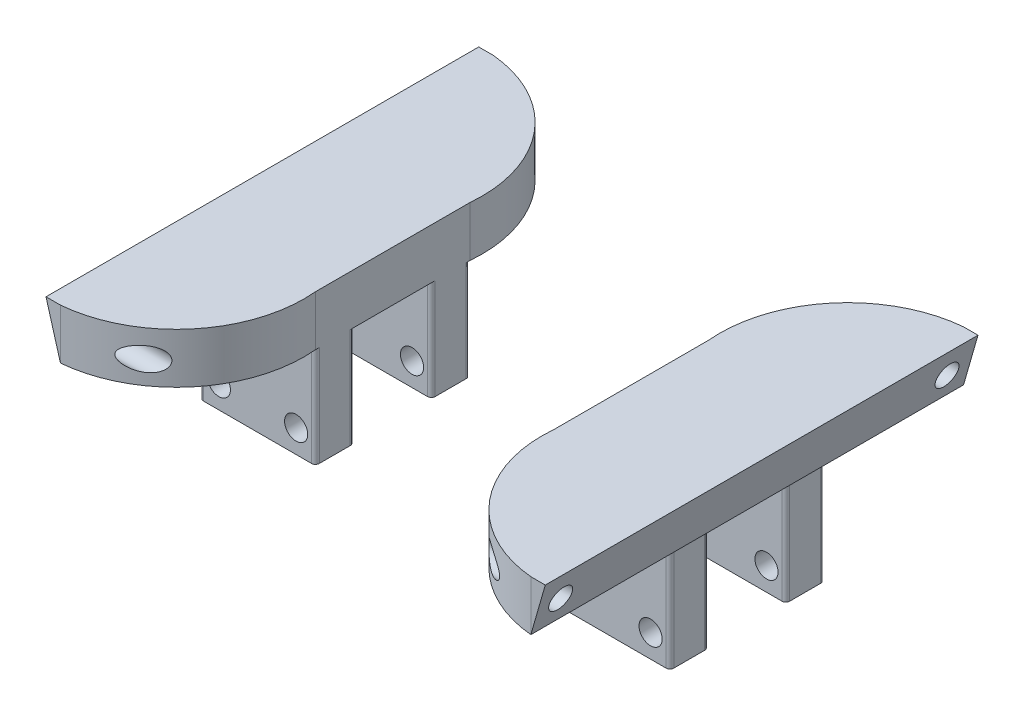
from build123d import *

# Parameters (mm, degrees)
BOSS_EXTRUDE1_DEPTH     = 62
CUT_EXTRUDE1_DEPTH      = 62
CUT_EXTRUDE1_DEPTH_BACK = 62
SKETCH2_R               = 1.5
CUT_EXTRUDE2_DEPTH      = 62
CUT_EXTRUDE2_DEPTH_BACK = 62
SKETCH3_W               = 8.022178305
SKETCH3_H               = 21.045195033
CUT_EXTRUDE3_DEPTH      = 62
CUT_EXTRUDE3_DEPTH_BACK = 62
SKETCH4_W               = 61.260270692
SKETCH4_H               = 6.493024082
SKETCH5_W               = 24.437419654
SKETCH5_H               = 5
BOSS_EXTRUDE2_DEPTH     = 13
SKETCH7_R               = 1.5
SKETCH7_W               = 30.874839308
SKETCH7_H               = 16.235122229
CUT_EXTRUDE4_DEPTH      = 23
CUT_EXTRUDE5_DEPTH      = 20
CUT_EXTRUDE5_DEPTH_BACK = 21
FILLET1_R               = 0.5
FILLET2_R               = 0.5
FILLET3_R               = 0.5
FILLET4_R               = 0.5
FILLET5_R               = 0.5
FILLET6_R               = 0.5
FILLET7_R               = 0.5
FILLET8_R               = 0.5
FILLET9_R               = 0.5
FILLET10_R              = 0.5
FILLET11_R              = 0.5
FILLET12_R              = 0.5
FILLET13_R              = 0.5
FILLET14_R              = 0.5
FILLET15_R              = 0.5
FILLET16_R              = 0.5


with BuildPart() as part:
    # Sketch1 → Boss-Extrude1 (new body)
    with BuildSketch(Plane.XY):
        Polygon((-42.357341369, -80), (17.367493653, -80), (19.811252759, -71.5), (-44.801100475, -71.5), align=None)
    extrude(amount=BOSS_EXTRUDE1_DEPTH)

    # Sketch2 → Cut-Extrude1 (cut, two sides: drawn at the far end of the back side and taken through both)
    with BuildSketch(Plane(origin=(0, 0, 0), x_dir=(0, 0, -1), z_dir=(1, 0, 0)).offset(-CUT_EXTRUDE1_DEPTH_BACK)):
        with Locations(Location((-53, -75, 0), (0, 0, 90))):
            Circle(SKETCH2_R)
        with Locations(Location((-3, -75, 0), (0, 0, 90))):
            Circle(SKETCH2_R)
    extrude(amount=CUT_EXTRUDE1_DEPTH + CUT_EXTRUDE1_DEPTH_BACK, mode=Mode.SUBTRACT)

    # Sketch3 → Cut-Extrude2 (cut, two sides: drawn at the far end of the back side and taken through both)
    with BuildSketch(Plane(origin=(0, 0, 0), x_dir=(0, 0, -1), z_dir=(1, 0, 0)).offset(-CUT_EXTRUDE2_DEPTH_BACK)):
        with Locations((-60.011089152, -76.583473071)):
            Rectangle(SKETCH3_W, SKETCH3_H)
    extrude(amount=CUT_EXTRUDE2_DEPTH + CUT_EXTRUDE2_DEPTH_BACK, mode=Mode.SUBTRACT)

    # Sketch4 → Cut-Extrude3 (cut, two sides: drawn at the far end of the back side and taken through both)
    with BuildSketch(Plane(origin=(0, 0, 0), x_dir=(0, 0, -1), z_dir=(1, 0, 0)).offset(-CUT_EXTRUDE3_DEPTH_BACK)):
        with Locations((-28, -81.246512041)):
            Rectangle(SKETCH4_W, SKETCH4_H)
    extrude(amount=CUT_EXTRUDE3_DEPTH + CUT_EXTRUDE3_DEPTH_BACK, mode=Mode.SUBTRACT)

    # Sketch5 → Boss-Extrude2 (add)
    with BuildSketch(Plane.XZ.offset(78)):
        with Locations((-30.713633685, 35.5)):
            Rectangle(SKETCH5_W, SKETCH5_H)
        with Locations((5.723785969, 35.5)):
            Rectangle(SKETCH5_W, SKETCH5_H)
        with Locations((-30.713633685, 20.5)):
            Rectangle(SKETCH5_W, SKETCH5_H)
        with Locations((5.723785969, 20.5)):
            Rectangle(SKETCH5_W, SKETCH5_H)
    extrude(amount=BOSS_EXTRUDE2_DEPTH)

    # Sketch7 → Cut-Extrude4 (cut)
    with BuildSketch(Plane(origin=(0, 0, 18), x_dir=(-1, 0, 0), z_dir=(0, 0, -1))):
        with Locations((-15.442495796, -88)):
            Circle(SKETCH7_R)
        with Locations((-5.442495796, -88)):
            Circle(SKETCH7_R)
        with Locations((30.432343512, -88)):
            Circle(SKETCH7_R)
        with Locations((40.432343512, -88)):
            Circle(SKETCH7_R)
        with Locations((12.494923858, -86.117561115)):
            Rectangle(SKETCH7_W, SKETCH7_H)
    extrude(amount=-CUT_EXTRUDE4_DEPTH, mode=Mode.SUBTRACT)

    # Sketch8 → Cut-Extrude5 (cut, two sides: drawn at the far end of the back side and taken through both)
    with BuildSketch(Plane.XZ.offset(78).offset(-CUT_EXTRUDE5_DEPTH_BACK)):
        with BuildLine():
            ThreePointArc((-42.932343512, 56), (-31.70442145, 50.106601718), (-27.932343512, 38))
            Line((-27.932343512, 38), (-27.932343512, 33))
            Line((-27.932343512, 33), (-27.932343512, 23))
            Line((-27.932343512, 23), (-27.932343512, 18))
            ThreePointArc((-27.932343512, 18), (-31.70442145, 5.893398282), (-42.932343512, 0))
            Line((-42.932343512, 0), (17.942495796, 0))
            ThreePointArc((17.942495796, 0), (6.714573734, 5.893398282), (2.942495796, 18))
            Line((2.942495796, 18), (2.942495796, 23))
            Line((2.942495796, 23), (2.942495796, 33))
            Line((2.942495796, 33), (2.942495796, 38))
            ThreePointArc((2.942495796, 38), (6.714573734, 50.106601718), (17.942495796, 56))
            Line((17.942495796, 56), (-42.932343512, 56))
        make_face()
    extrude(amount=CUT_EXTRUDE5_DEPTH + CUT_EXTRUDE5_DEPTH_BACK, mode=Mode.SUBTRACT)


with BuildPart() as cut_extrude5_piece_1:
    # of the separate pieces the step leaves, piece 1, a body of its own (cut_extrude5_pieces)
    add(part.part.solids().sort_by_distance((17.942495796, -71.5, 0))[0])

    # Fillet1
    fillet1_edges = [cut_extrude5_piece_1.edges().sort_by_distance(p)[0] for p in [
        (17.942495796, -84.5, 33),
    ]]
    fillet(fillet1_edges, radius=FILLET1_R)

    # Fillet2
    fillet2_edges = [cut_extrude5_piece_1.edges().sort_by_distance(p)[0] for p in [
        (17.942495796, -84.5, 38),
    ]]
    fillet(fillet2_edges, radius=FILLET2_R)

    # Fillet3
    # the kernel refuses this fillet: 0.5 mm, written as the material it takes off along each edge
    with BuildSketch(Plane(origin=(17.942495796, -78, 23), x_dir=(-1, 0, 0), z_dir=(0, -1, 0))) as fillet3_piece_1_section:
        with BuildLine():
            CenterArc((FILLET3_R, FILLET3_R), FILLET3_R, 180, 90)
            Line((0, FILLET3_R), (0, 0))
            Line((0, 0), (FILLET3_R, 0))
        make_face()
    fillet3_piece_1 = extrude(amount=14.25, mode=Mode.PRIVATE)
    fillet3_piece_1 = split(fillet3_piece_1, bisect_by=Plane(origin=(17.826756801, -78.402568918, 22.946763744), z_dir=(-0.9610690305242926, 0.2763083758540381, 0)), keep=Keep.TOP, mode=Mode.PRIVATE)
    add(fillet3_piece_1, mode=Mode.SUBTRACT)
    with BuildSketch(Plane(origin=(17.942495796, -78, 23), x_dir=(-1, 0, 0), z_dir=(0, -1, 0))) as fillet3_piece_2_section:
        with BuildLine():
            CenterArc((FILLET3_R, FILLET3_R), FILLET3_R, 180, 90)
            Line((0, FILLET3_R), (0, 0))
            Line((0, 0), (FILLET3_R, 0))
        make_face()
    fillet3_piece_2 = extrude(amount=14.25, mode=Mode.PRIVATE)
    fillet3_piece_2 = split(fillet3_piece_2, bisect_by=Plane(origin=(15.990895382, -84.788150058, 22.885092436), z_dir=(0.9610690305242926, -0.2763083758540381, 0)), keep=Keep.TOP, mode=Mode.PRIVATE)
    add(fillet3_piece_2, mode=Mode.SUBTRACT)

    # Fillet4
    fillet4_edges = [cut_extrude5_piece_1.edges().sort_by_distance(p)[0] for p in [
        (17.942495796, -84.5, 18),
    ]]
    fillet(fillet4_edges, radius=FILLET4_R)

    # Fillet5
    fillet5_edges = [cut_extrude5_piece_1.edges().sort_by_distance(p)[0] for p in [
        (2.942495796, -84.5, 18),
    ]]
    fillet(fillet5_edges, radius=FILLET5_R)

    # Fillet6
    fillet6_edges = [cut_extrude5_piece_1.edges().sort_by_distance(p)[0] for p in [
        (2.942495796, -84.5, 33),
    ]]
    fillet(fillet6_edges, radius=FILLET6_R)

    # Fillet7
    fillet7_edges = [cut_extrude5_piece_1.edges().sort_by_distance(p)[0] for p in [
        (2.942495796, -84.5, 23),
    ]]
    fillet(fillet7_edges, radius=FILLET7_R)

    # Fillet8
    fillet8_edges = [cut_extrude5_piece_1.edges().sort_by_distance(p)[0] for p in [
        (2.942495796, -84.5, 38),
    ]]
    fillet(fillet8_edges, radius=FILLET8_R)


with BuildPart() as cut_extrude5_piece_2:
    # of the separate pieces the step leaves, piece 2, a body of its own (cut_extrude5_pieces)
    add(part.part.solids().sort_by_distance((-42.932343512, -71.5, 0))[0])

    # Fillet9
    fillet9_edges = [cut_extrude5_piece_2.edges().sort_by_distance(p)[0] for p in [
        (-42.932343512, -84.5, 18),
    ]]
    fillet(fillet9_edges, radius=FILLET9_R)

    # Fillet10
    fillet10_edges = [cut_extrude5_piece_2.edges().sort_by_distance(p)[0] for p in [
        (-27.932343512, -84.5, 18),
    ]]
    fillet(fillet10_edges, radius=FILLET10_R)

    # Fillet11
    fillet11_edges = [cut_extrude5_piece_2.edges().sort_by_distance(p)[0] for p in [
        (-27.932343512, -84.5, 23),
    ]]
    fillet(fillet11_edges, radius=FILLET11_R)

    # Fillet12
    fillet12_edges = [cut_extrude5_piece_2.edges().sort_by_distance(p)[0] for p in [
        (-27.932343512, -84.5, 33),
    ]]
    fillet(fillet12_edges, radius=FILLET12_R)

    # Fillet13
    fillet13_edges = [cut_extrude5_piece_2.edges().sort_by_distance(p)[0] for p in [
        (-27.932343512, -84.5, 38),
    ]]
    fillet(fillet13_edges, radius=FILLET13_R)

    # Fillet14
    fillet14_edges = [cut_extrude5_piece_2.edges().sort_by_distance(p)[0] for p in [
        (-42.932343512, -84.5, 38),
    ]]
    fillet(fillet14_edges, radius=FILLET14_R)

    # Fillet15
    fillet15_edges = [cut_extrude5_piece_2.edges().sort_by_distance(p)[0] for p in [
        (-42.932343512, -84.5, 33),
    ]]
    fillet(fillet15_edges, radius=FILLET15_R)

    # Fillet16
    # the kernel refuses this fillet: 0.5 mm, written as the material it takes off along each edge
    with BuildSketch(Plane(origin=(-42.932343512, -78, 23), x_dir=(0, 0, -1), z_dir=(0, -1, 0))) as fillet16_piece_1_section:
        with BuildLine():
            CenterArc((FILLET16_R, FILLET16_R), FILLET16_R, 180, 90)
            Line((0, FILLET16_R), (0, 0))
            Line((0, 0), (FILLET16_R, 0))
        make_face()
    fillet16_piece_1 = extrude(amount=14.25, mode=Mode.PRIVATE)
    fillet16_piece_1 = split(fillet16_piece_1, bisect_by=Plane(origin=(-42.816604516, -78.402568918, 22.946763744), z_dir=(0.9610690305242929, 0.2763083758540371, 0)), keep=Keep.TOP, mode=Mode.PRIVATE)
    add(fillet16_piece_1, mode=Mode.SUBTRACT)
    with BuildSketch(Plane(origin=(-42.932343512, -78, 23), x_dir=(0, 0, -1), z_dir=(0, -1, 0))) as fillet16_piece_2_section:
        with BuildLine():
            CenterArc((FILLET16_R, FILLET16_R), FILLET16_R, 180, 90)
            Line((0, FILLET16_R), (0, 0))
            Line((0, 0), (FILLET16_R, 0))
        make_face()
    fillet16_piece_2 = extrude(amount=14.25, mode=Mode.PRIVATE)
    fillet16_piece_2 = split(fillet16_piece_2, bisect_by=Plane(origin=(-40.980743098, -84.788150058, 22.885092436), z_dir=(-0.9610690305242929, -0.2763083758540371, 0)), keep=Keep.TOP, mode=Mode.PRIVATE)
    add(fillet16_piece_2, mode=Mode.SUBTRACT)


solid = Compound([cut_extrude5_piece_1.part, cut_extrude5_piece_2.part])
